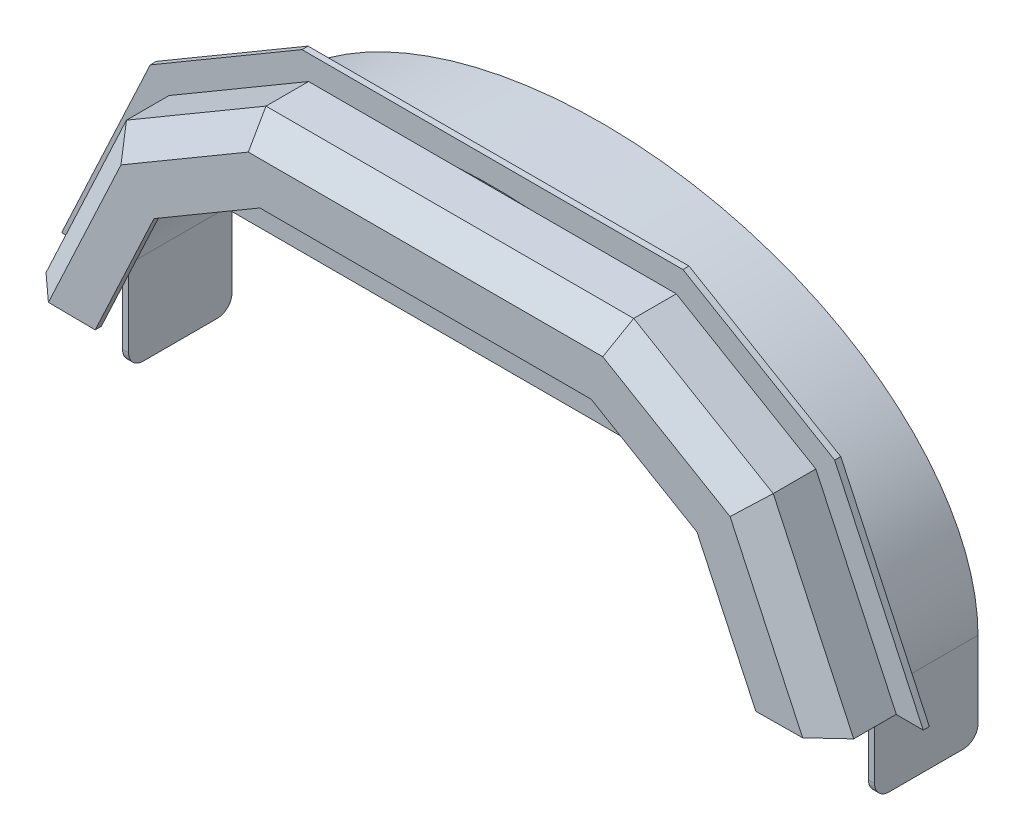
from build123d import *

# Parameters (mm, degrees)
THICKEN2_START      = -170
THICKEN2_DEPTH      = 170
THICKEN3_DEPTH      = 10
CUT_EXTRUDE3_DEPTH  = 170
BOSS_EXTRUDE1_DEPTH = 110
THICKEN4_START      = 110
THICKEN4_DEPTH      = 10
CHAMFER1_SIZE       = 40
THICKEN7_START      = -170
THICKEN7_DEPTH      = 10
SKETCH17_W          = 10
SKETCH17_H          = 170
BOSS_EXTRUDE5_DEPTH = 150
FILLET4_R           = 24
SKETCH18_W          = 10
SKETCH18_H          = 170
BOSS_EXTRUDE7_DEPTH = 150
FILLET5_R           = 24


# Read off the part's stored shape, not the designer's step: Thicken2, Thicken3, Thicken4, Thicken7
with BuildPart() as part:
    # Thicken2 outline → Thicken2 (new body)
    with BuildSketch(Plane.XY.offset(THICKEN2_START)):
        with BuildLine():
            add(Edge.make_bspline(
                [(618.109, -210), (618.109, 210), (0, 210), (-618.109, 210), (-618.109, -210)],
                knots=[3.141592654, 3.141592654, 3.141592654, 4.71238898, 4.71238898, 6.283185307, 6.283185307, 6.283185307], degree=2, weights=[1, 0.707106781, 1, 0.707106781, 1]))
            Line((-618.109, -210), (-608.109, -210))
            add(Edge.make_bspline(
                [(608.109, -210), (608.109, -178.169138264), (604.021009509, -146.338281935), (595.844886564, -114.745443498), (583.609128592, -83.629021392), (567.36772493, -53.235783491), (547.220517356, -23.837756615), (523.327535994, 4.300283975), (495.894395609, 30.924013141), (465.172197728, 55.798883735), (397.725481971, 101.628374355), (361.000979724, 122.583000299), (321.563329671, 141.366245943), (279.737999651, 157.790376773), (235.881484639, 171.69534484), (190.375085568, 182.951103868), (143.618765994, 191.459039648), (96.024990274, 197.153007487), (48.012495722, 200), (-48.012495722, 200), (-96.024990274, 197.153007487), (-143.618765994, 191.459039648), (-190.375085568, 182.951103868), (-235.881484639, 171.69534484), (-279.737999651, 157.790376773), (-321.563329671, 141.366245943), (-361.000979724, 122.583000299), (-397.725481971, 101.628374355), (-465.172197728, 55.798883735), (-495.894395609, 30.924013141), (-523.327535994, 4.300283975), (-547.220517356, -23.837756615), (-567.36772493, -53.235783491), (-583.609128592, -83.629021392), (-595.844886564, -114.745443498), (-604.021009509, -146.338281935), (-608.109, -178.169138264), (-608.109, -210)],
                knots=[3.141592654, 3.141592654, 3.141592654, 3.141592654, 3.141592654, 3.141592654, 3.141592654, 3.141592654, 3.141592654, 3.141592654, 3.141592654, 3.926990817, 3.926990817, 3.926990817, 3.926990817, 3.926990817, 3.926990817, 3.926990817, 3.926990817, 3.926990817, 4.71238898, 4.71238898, 4.71238898, 4.71238898, 4.71238898, 4.71238898, 4.71238898, 4.71238898, 4.71238898, 5.497787144, 5.497787144, 5.497787144, 5.497787144, 5.497787144, 5.497787144, 5.497787144, 5.497787144, 5.497787144, 6.283185307, 6.283185307, 6.283185307, 6.283185307, 6.283185307, 6.283185307, 6.283185307, 6.283185307, 6.283185307, 6.283185307, 6.283185307], degree=10))
            Line((608.109, -210), (618.109, -210))
        make_face()
    extrude(amount=THICKEN2_DEPTH)

    # Thicken3 outline → Thicken3 (add)
    with BuildSketch(Plane.XY):
        with BuildLine():
            Line((-708.109, -210), (-618.109, -210))
            add(Edge.make_bspline(
                [(-618.109, -210), (-618.109, 210), (0, 210), (618.109, 210), (618.109, -210)],
                knots=[0, 0, 0, 1.570796327, 1.570796327, 3.141592654, 3.141592654, 3.141592654], degree=2, weights=[1, 0.707106781, 1, 0.707106781, 1]))
            Line((618.109, -210), (708.109, -210))
            add(Edge.make_bspline(
                [(708.109, -210), (708.109, -137.273531736), (686.607025116, -65.966206286), (609.367846415, 60.841841668), (553.73545596, 116.521413825), (355.480996182, 251.233694517), (178.84515525, 300), (-178.84515525, 300), (-355.480996182, 251.233694517), (-553.73545596, 116.521413825), (-609.367846415, 60.841841668), (-686.607025116, -65.966206286), (-708.109, -137.273531736), (-708.109, -210)],
                knots=[0, 0, 0, 0, 0.125, 0.125, 0.25, 0.25, 0.5, 0.5, 0.75, 0.75, 0.875, 0.875, 1, 1, 1, 1], degree=3))
        make_face()
    extrude(amount=THICKEN3_DEPTH)

    # Sketch11 → Cut-Extrude3 (cut)
    with BuildSketch(Plane.XY.offset(10)):
        Polygon((-708.109, -210), (-562.526529663, 101.615060205), (-313.069442385, 248.07436453), (0, 248.07436453), (313.069442385, 248.07436453), (562.526529663, 101.615060205), (708.109, -210), (708.109, 560.037364463), (-801.973175437, 560.037364463), (-801.973175437, -210), align=None)
    extrude(amount=-CUT_EXTRUDE3_DEPTH, mode=Mode.SUBTRACT)

    # Sketch13 → Boss-Extrude1 (add)
    with BuildSketch(Plane.XY.offset(10)):
        Polygon((-663.806721408, -209.674033706), (-531.550245219, 73.417122082), (-302.195042169, 208.07436453), (302.195042169, 208.07436453), (531.550245219, 73.417122082), (663.806721408, -209.674033706), (630.846515026, -210), (508.318031886, 52.268668489), (294.039242007, 178.07436453), (-294.039242007, 178.07436453), (-508.318031886, 52.268668489), (-630.846515026, -210), align=None)
    extrude(amount=BOSS_EXTRUDE1_DEPTH)

    # Thicken4 outline → Thicken4 (add)
    with BuildSketch(Plane.XY.offset(THICKEN4_START)):
        Polygon((-630.846515026, -210), (-542.952631342, -210.869243449), (-446.365462998, -4.127207757), (-272.290441574, 98.07436453), (272.290441574, 98.07436453), (446.365462998, -4.127207757), (542.952631342, -210.869243449), (630.846515026, -210), (616.44098442, -179.165379069), (508.318031886, 52.268668489), (294.039242007, 178.07436453), (-294.039242007, 178.07436453), (-508.318031886, 52.268668489), (-616.44098442, -179.165379069), align=None)
    extrude(amount=THICKEN4_DEPTH)

    # Chamfer1
    chamfer1_edges = [part.edges().sort_by_distance(p)[0] for p in [
        (597.678483314, -68.128455812, 120),
        (416.872643694, 140.745743306, 120),
        (0, 208.07436453, 120),
        (-416.872643694, 140.745743306, 120),
        (-597.678483314, -68.128455812, 120),
    ]]
    chamfer(chamfer1_edges, length=CHAMFER1_SIZE - 0.0001)  # a hair under: the kernel refuses the full size

    # Thicken7 outline → Thicken7 (add)
    with BuildSketch(Plane.XY.offset(THICKEN7_START)):
        with BuildLine():
            add(Edge.make_bspline(
                [(-608.109, -210), (-608.109, -183.474922657), (-604.26826592, -156.947127676), (-589.00168335, -104.795932247), (-577.572942017, -79.171976519), (-547.46640577, -29.784060453), (-528.787707586, -6.023131192), (-484.829642718, 38.679203094), (-459.551638082, 59.618007953), (-403.346041618, 97.809250137), (-372.420471807, 115.060229765), (-306.117294084, 145.163325064), (-270.74173878, 158.014647751), (-196.919844791, 178.792168334), (-158.47553767, 186.717913153), (-80.019801302, 197.321937406), (-40.010413102, 200), (40.010413102, 200), (80.019801302, 197.321937406), (158.47553767, 186.717913153), (196.919844791, 178.792168334), (270.74173878, 158.014647751), (306.117294084, 145.163325064), (372.420471807, 115.060229765), (403.346041618, 97.809250137), (459.551638082, 59.618007953), (484.829642718, 38.679203094), (528.787707586, -6.023131192), (547.46640577, -29.784060453), (577.572942017, -79.171976519), (589.00168335, -104.795932247), (604.26826592, -156.947127676), (608.109, -183.474922657), (608.109, -210)],
                knots=[0, 0, 0, 0, 0.196349541, 0.196349541, 0.392699082, 0.392699082, 0.589048623, 0.589048623, 0.785398163, 0.785398163, 0.981747704, 0.981747704, 1.178097245, 1.178097245, 1.374446786, 1.374446786, 1.570796327, 1.570796327, 1.767145868, 1.767145868, 1.963495408, 1.963495408, 2.159844949, 2.159844949, 2.35619449, 2.35619449, 2.552544031, 2.552544031, 2.748893572, 2.748893572, 2.945243113, 2.945243113, 3.141592654, 3.141592654, 3.141592654, 3.141592654], degree=3))
            Line((-608.109, -210), (-9.357031524, -210))
            add(Edge.make_bspline(
                [(9.357031524, -210), (6.240662185, -209.933734435), (3.120741203, -209.9), (-3.120741203, -209.9), (-6.240662185, -209.933734435), (-9.357031524, -210)],
                knots=[0.486798289, 0.486798289, 0.486798289, 0.486798289, 0.5, 0.5, 0.513201711, 0.513201711, 0.513201711, 0.513201711], degree=3))
            Line((9.357031524, -210), (608.109, -210))
        make_face()
    extrude(amount=THICKEN7_DEPTH)


with BuildPart() as body_2:
    # Sketch17 → Boss-Extrude5 (new body)
    with BuildSketch(Plane.XZ.offset(210)):
        with Locations((613.109, -85)):
            Rectangle(SKETCH17_W, SKETCH17_H)
    extrude(amount=BOSS_EXTRUDE5_DEPTH)

    # Fillet4
    fillet4_edges = [body_2.edges().sort_by_distance(p)[0] for p in [
        (613.109, -360, -170),
        (613.109, -360, 0),
    ]]
    fillet(fillet4_edges, radius=FILLET4_R)


with BuildPart() as body_3:
    # Sketch18 → Boss-Extrude7 (new body)
    with BuildSketch(Plane.XZ.offset(210)):
        with Locations((-613.109, -85)):
            Rectangle(SKETCH18_W, SKETCH18_H)
    extrude(amount=BOSS_EXTRUDE7_DEPTH)

    # Fillet5
    fillet5_edges = [body_3.edges().sort_by_distance(p)[0] for p in [
        (-613.109, -360, -170),
        (-613.109, -360, 0),
    ]]
    fillet(fillet5_edges, radius=FILLET5_R)


solid = Compound([part.part, body_2.part, body_3.part])
